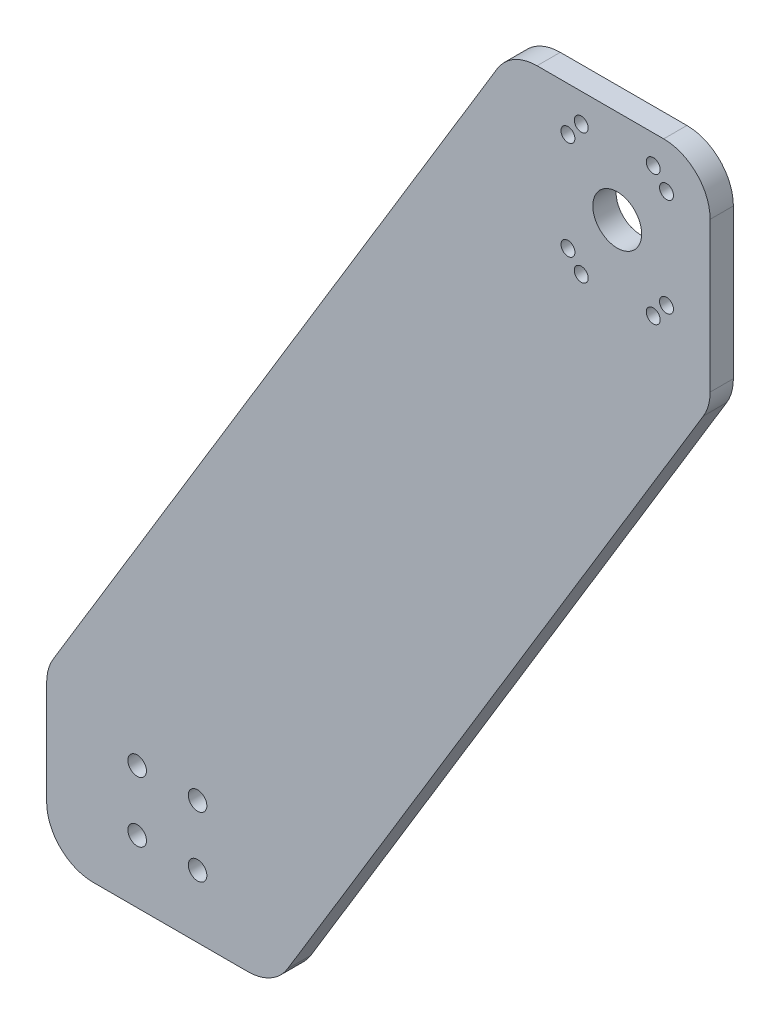
from build123d import *

# Parameters (mm, degrees)
SCHIZZO1_R                   = 4
SCHIZZO1_R_2                 = 10.5
SCHIZZO1_R_3                 = 3
ESTRUSIONE_ESTRUSIONE2_DEPTH = 10
SCHIZZO2_R                   = 2
TAGLIO_ESTRUSIONE1_DEPTH     = 15


with BuildPart() as part:
    # Schizzo1 → Estrusione-Estrusione2 (new body)
    with BuildSketch(Plane.XY):
        with BuildLine():
            Line((20, 0), (86.62818051, 0))
            ThreePointArc((86.62818051, 0), (96.446255583, 2.575723778), (103.735465714, 9.639459813))
            Line((103.735465714, 9.639459813), (282.747559913, 305.223560148))
            ThreePointArc((282.747559913, 305.223560148), (284.903526046, 310.205703923), (285.64027471, 315.584100335))
            Line((285.64027471, 315.584100335), (285.64027471, 380))
            ThreePointArc((285.64027471, 380), (279.782410334, 394.142135624), (265.64027471, 400))
            Line((265.64027471, 400), (211.12452474, 400))
            ThreePointArc((211.12452474, 400), (201.306449667, 397.424276222), (194.017239536, 390.360540187))
            Line((194.017239536, 390.360540187), (2.892714797, 74.776439852))
            ThreePointArc((2.892714797, 74.776439852), (0.736748664, 69.794296077), (0, 64.415899665))
            Line((0, 64.415899665), (0, 20))
            ThreePointArc((0, 20), (5.857864376, 5.857864376), (20, 0))
        make_face()
        with Locations((38.976908306, 53)):
            Circle(SCHIZZO1_R, mode=Mode.SUBTRACT)
        with Locations((64.976908306, 53)):
            Circle(SCHIZZO1_R, mode=Mode.SUBTRACT)
        with Locations((64.976908306, 27)):
            Circle(SCHIZZO1_R, mode=Mode.SUBTRACT)
        with Locations((38.976908306, 27)):
            Circle(SCHIZZO1_R, mode=Mode.SUBTRACT)
        with Locations((245.64027471, 359.776226195)):
            Circle(SCHIZZO1_R_2, mode=Mode.SUBTRACT)
        with Locations((230.14027471, 387.776226195)):
            Circle(SCHIZZO1_R_3, mode=Mode.SUBTRACT)
        with Locations((261.14027471, 387.776226195)):
            Circle(SCHIZZO1_R_3, mode=Mode.SUBTRACT)
        with Locations((266.853478146, 380.98942963)):
            Circle(SCHIZZO1_R_3, mode=Mode.SUBTRACT)
        with Locations((266.853478146, 338.563022759)):
            Circle(SCHIZZO1_R_3, mode=Mode.SUBTRACT)
        with Locations((261.14027471, 331.776226195)):
            Circle(SCHIZZO1_R_3, mode=Mode.SUBTRACT)
        with Locations((230.14027471, 331.776226195)):
            Circle(SCHIZZO1_R_3, mode=Mode.SUBTRACT)
        with Locations((224.427071275, 338.563022759)):
            Circle(SCHIZZO1_R_3, mode=Mode.SUBTRACT)
        with Locations((224.427071275, 380.98942963)):
            Circle(SCHIZZO1_R_3, mode=Mode.SUBTRACT)
    extrude(amount=-ESTRUSIONE_ESTRUSIONE2_DEPTH)

    # Schizzo2 → Taglio-Estrusione1 (cut)
    with BuildSketch(Plane.XZ):
        with Locations((53.314090255, -5)):
            Circle(SCHIZZO2_R)
        with Locations((80.814090255, -5)):
            Circle(SCHIZZO2_R)
        with Locations((25.814090255, -5)):
            Circle(SCHIZZO2_R)
    extrude(amount=-TAGLIO_ESTRUSIONE1_DEPTH, mode=Mode.SUBTRACT)


solid = part.part
